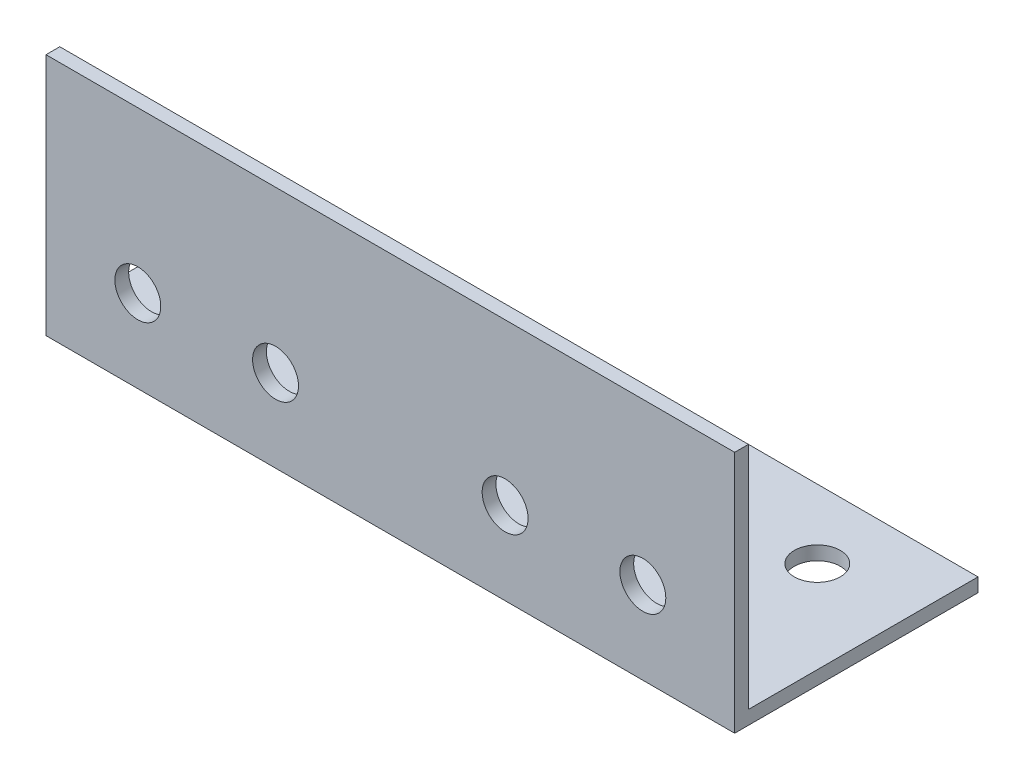
from build123d import *

# Parameters (mm, degrees)
EXTRUDE_1_DEPTH     = 150
SKETCH_2_R          = 5
CUT_EXTRUDE_1_DEPTH = 167.760307028
SKETCH_3_R          = 5
CUT_EXTRUDE_3_DEPTH = 167.760307028


with BuildPart() as part:
    # Эскиз1 → Вытянуть-Тонкостенный1 (new body)
    with BuildSketch(Plane(origin=(0, 0, 0), x_dir=(0, 0, -1), z_dir=(1, 0, 0))):
        Polygon((50, 0), (0, 0), (0, 50), (-3, 50), (-3, -3), (50, -3), align=None)
    extrude(amount=EXTRUDE_1_DEPTH)

    # Эскиз2 → Вырез-Вытянуть1 (cut, through all)
    with BuildSketch(Plane.XZ.offset(3)):
        with Locations((130, -35)):
            Circle(SKETCH_2_R)
        with Locations((100, -35)):
            Circle(SKETCH_2_R)
        with Locations((50, -35)):
            Circle(SKETCH_2_R)
        with Locations((20, -35)):
            Circle(SKETCH_2_R)
    extrude(amount=-CUT_EXTRUDE_1_DEPTH, mode=Mode.SUBTRACT)

    # Эскиз3 → Вырез-Вытянуть3 (cut, through all)
    with BuildSketch(Plane.XY.offset(3)):
        with Locations((130, 15)):
            Circle(SKETCH_3_R)
        with Locations((100, 15)):
            Circle(SKETCH_3_R)
        with Locations((50, 15)):
            Circle(SKETCH_3_R)
        with Locations((20, 15)):
            Circle(SKETCH_3_R)
    extrude(amount=-CUT_EXTRUDE_3_DEPTH, mode=Mode.SUBTRACT)


solid = part.part
